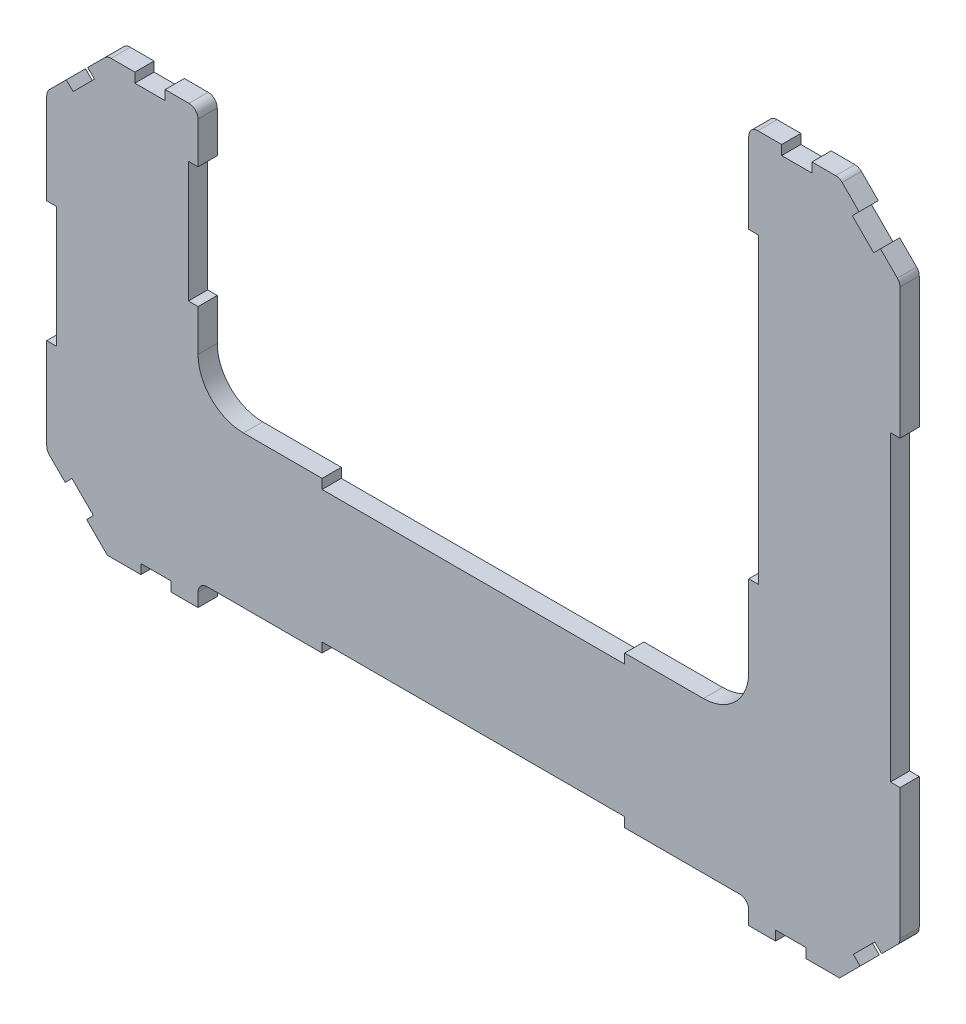
from build123d import *

# Parameters (mm, degrees)
BOSS_EXTRUDE1_DEPTH      = 3.175
BOSS_EXTRUDE1_DEPTH_BACK = 3.175
CHAMFER1_SIZE            = 20
FILLET1_R                = 15
FILLET2_R                = 3
SKETCH4_W                = 10
SKETCH4_H                = 3.175
SKETCH4_W_2              = 3.175
SKETCH4_H_2              = 100
SKETCH4_W_3              = 100
SKETCH4_H_3              = 40
WALL_SLOTS_DEPTH         = 60


with BuildPart() as part:
    # Sketch2 → Boss-Extrude1 (new, two sides: drawn at the far end of the back side and taken through both)
    with BuildSketch(Plane.XY.offset(-BOSS_EXTRUDE1_DEPTH_BACK)):
        Polygon((-141, 85.338455572), (-91, 85.338455572), (-91, 0), (91, 0), (91, 171.5), (141, 171.5), (141, -57.5), (91, -57.5), (91, -50), (-91, -50), (-91, -57.5), (-141, -57.5), align=None)
    extrude(amount=BOSS_EXTRUDE1_DEPTH + BOSS_EXTRUDE1_DEPTH_BACK)

    # Chamfer1
    chamfer1_edges = [part.edges().sort_by_distance(p)[0] for p in [
        (-141, -57.5, 0),
        (141, -57.5, 0),
        (141, 171.5, 0),
        (-141, 85.338455572, 0),
    ]]
    chamfer(chamfer1_edges, length=CHAMFER1_SIZE)

    # Fillet1
    fillet1_edges = [part.edges().sort_by_distance(p)[0] for p in [
        (91, 0, 0),
        (-91, 0, 0),
    ]]
    fillet(fillet1_edges, radius=FILLET1_R)

    # Fillet2
    fillet2_edges = [part.edges().sort_by_distance(p)[0] for p in [
        (141, -37.5, 0),
        (91, -50, 0),
        (-91, -50, 0),
        (-141, -37.5, 0),
        (-141, 65.338455572, 0),
        (-121, 85.338455572, 0),
        (-91, 85.338455572, 0),
        (141, 151.5, 0),
        (121, 171.5, 0),
        (91, 171.5, 0),
    ]]
    fillet(fillet2_edges, radius=FILLET2_R)

    # Sketch4 → wall_slots (cut)
    with BuildSketch(Plane.XY.offset(3.175)):
        with Locations((106.878679656, 169.9125)):
            Rectangle(SKETCH4_W, SKETCH4_H)
        Polygon((134.535533906, 157.964466094), (127.464466094, 165.035533906), (125.219402064, 162.790469876), (132.290469876, 155.719402064), align=None)
        with Locations((92.5875, 91.75)):
            Rectangle(SKETCH4_W_2, SKETCH4_H_2)
        with Locations((139.4125, 57)):
            Rectangle(SKETCH4_W_2, SKETCH4_H_2)
        with Locations((0, -1.5875)):
            Rectangle(SKETCH4_W_3, SKETCH4_H)
        with Locations((0, -48.4125)):
            Rectangle(SKETCH4_W_3, SKETCH4_H)
        with Locations((-139.4125, 13.919227786)):
            Rectangle(SKETCH4_W_2, SKETCH4_H_3)
        Polygon((-127.464466094, 78.873989478), (-134.535533906, 71.802921666), (-132.290469876, 69.557857636), (-125.219402064, 76.628925448), align=None)
        with Locations((-106.878679656, 83.750955572)):
            Rectangle(SKETCH4_W, SKETCH4_H)
        with Locations((-92.5875, 48.669227786)):
            Rectangle(SKETCH4_W_2, SKETCH4_H_3)
        Polygon((-134.891689207, -43.608310793), (-127.820621395, -50.679378605), (-125.575557364, -48.434314575), (-132.646625176, -41.363246763), align=None)
        with Locations((-104.875, -55.9125)):
            Rectangle(SKETCH4_W, SKETCH4_H)
        Polygon((125.575557364, -48.434314575), (127.820621395, -50.679378605), (134.891689207, -43.608310793), (132.646625176, -41.363246763), align=None)
        with Locations((104.875, -55.9125)):
            Rectangle(SKETCH4_W, SKETCH4_H)
    extrude(amount=-WALL_SLOTS_DEPTH, mode=Mode.SUBTRACT)


solid = part.part
